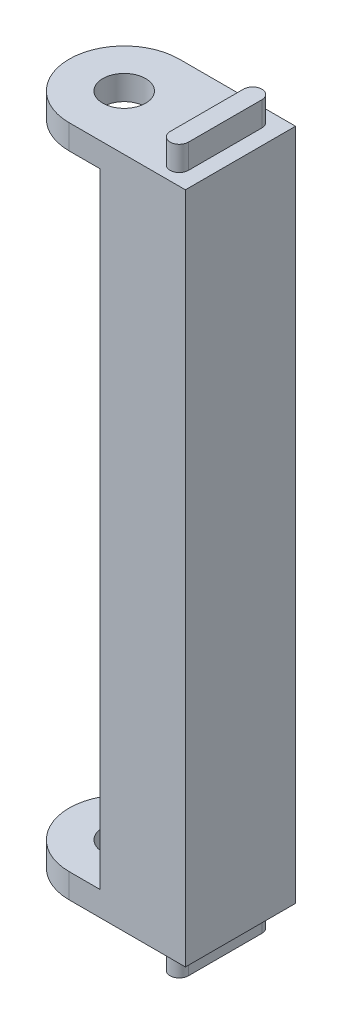
from build123d import *

# Parameters (mm, degrees)
SKETCH1_R           = 1.75
BOSS_EXTRUDE3_DEPTH = 2
BOSS_EXTRUDE4_DEPTH = 25.5
BOSS_EXTRUDE5_DEPTH = 4


with BuildPart() as part:
    # Sketch1 → Boss-Extrude3 (new body)
    with BuildSketch(Plane(origin=(0, 0, 0), x_dir=(1, 0, 0), z_dir=(0, 1, 0))):
        with BuildLine():
            ThreePointArc((-2.5, 4.5), (-7, 0), (-2.5, -4.5))
            Line((-2.5, -4.5), (7, -4.5))
            Line((7, -4.5), (7, 4.5))
            Line((7, 4.5), (-2.5, 4.5))
        make_face()
        with Locations((-2.5, 0)):
            Circle(SKETCH1_R, mode=Mode.SUBTRACT)
    extrude(amount=BOSS_EXTRUDE3_DEPTH)

    # Sketch1<3> → Boss-Extrude4 (add)
    with BuildSketch(Plane(origin=(0, 0, 0), x_dir=(1, 0, 0), z_dir=(0, 1, 0))):
        with BuildLine():
            ThreePointArc((0.004495957, 4.5), (2.65, 0), (0.004495957, -4.5))
            Line((0.004495957, -4.5), (7, -4.5))
            Line((7, -4.5), (7, 4.5))
            Line((7, 4.5), (0.004495957, 4.5))
        make_face()
    extrude(amount=-BOSS_EXTRUDE4_DEPTH)

    # Sketch1<5> → Boss-Extrude5 (add)
    with BuildSketch(Plane(origin=(0, 0, 0), x_dir=(1, 0, 0), z_dir=(0, 1, 0))):
        with BuildLine():
            Line((5.75, -3), (5.75, 3))
            ThreePointArc((5.75, 3), (5, 3.75), (4.25, 3))
            Line((4.25, 3), (4.25, -3))
            ThreePointArc((4.25, -3), (5, -3.75), (5.75, -3))
        make_face()
    extrude(amount=BOSS_EXTRUDE5_DEPTH)

    # Mirror1: part across plane


with BuildPart() as part_1:
    add(part.part)
    add(part.part.mirror(Plane.ZX.offset(-25.5)))


solid = part_1.part
